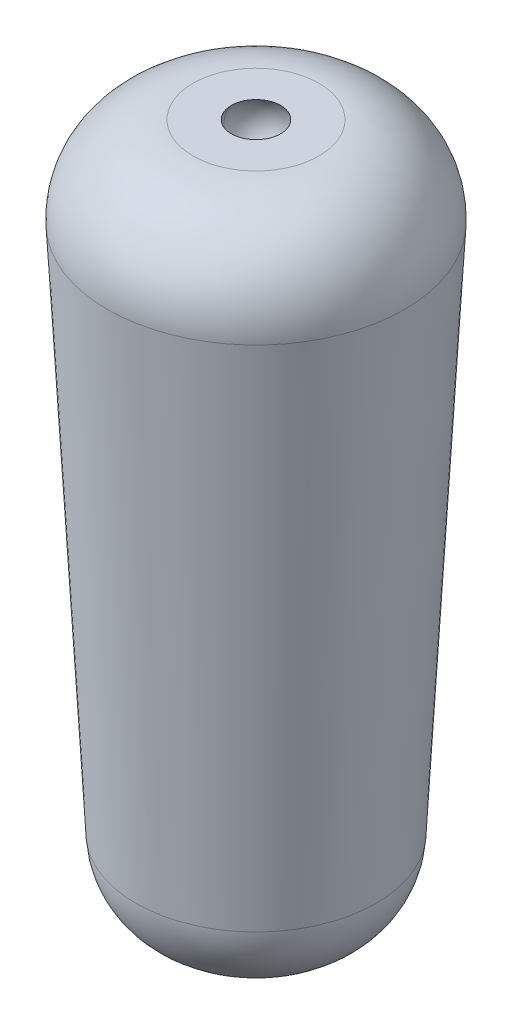
from build123d import *

# Parameters (mm, degrees)
SKETCH1_R           = 90.957734813
SKETCH2_R           = 68.723621859
FILLET1_R           = 50.8
SKETCH5_R           = 19.05
BOSS_EXTRUDE1_DEPTH = 19.05
FILLET2_R           = 19.05
SKETCH6_R           = 19.05
CUT_EXTRUDE1_DEPTH  = 2.54


with BuildPart() as part:
    # Sketch1 → Loft1 section 0
    with BuildSketch(Plane(origin=(0, 0, 0), x_dir=(1, 0, 0), z_dir=(0, 1, 0))):
        Circle(SKETCH1_R)
    # Sketch2 → Loft1 section 1
    with BuildSketch(Plane(origin=(0, -415, 0), x_dir=(-1, 0, 0), z_dir=(0, 1, 0))):
        Circle(SKETCH2_R)
    loft()

    # Fillet1
    fillet1_edges = [part.edges().sort_by_distance(p)[0] for p in [
        (-68.723621859, -415, 0),
        (-90.957734813, 0, 0),
    ]]
    fillet(fillet1_edges, radius=FILLET1_R)


with BuildPart() as body_2:
    # Sketch5 → Boss-Extrude1 (new, symmetric)
    with BuildSketch(Plane.XY):
        with Locations(Location((0, -12.241562165, 0), (0, 0, 180))):
            Circle(SKETCH5_R)
    extrude(amount=BOSS_EXTRUDE1_DEPTH, both=True)

    # Fillet2
    fillet2_edges = [body_2.edges().sort_by_distance(p)[0] for p in [
        (19.05, -12.241562165, -19.05),
        (19.05, -12.241562165, 19.05),
    ]]
    fillet(fillet2_edges, radius=FILLET2_R - 0.0001)  # a hair under: the kernel refuses the full size


with BuildPart() as part_1:
    add(part.part)

    # Combine1: cut body 2
    add(body_2.part, mode=Mode.SUBTRACT)

    # Sketch6 → Cut-Extrude1 (cut)
    with BuildSketch(Plane.XZ.offset(415)):
        with Locations(Location((0, 0, 0), (0, 0, 270))):
            Circle(SKETCH6_R)
    extrude(amount=-CUT_EXTRUDE1_DEPTH, mode=Mode.SUBTRACT)


solid = part_1.part
